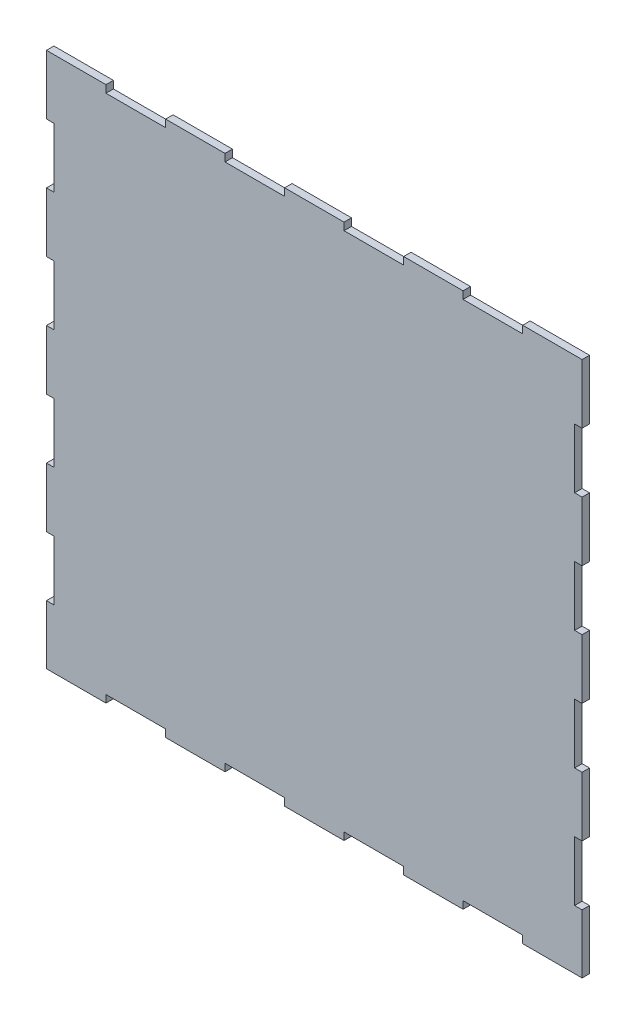
from build123d import *

# Parameters (mm, degrees)
SKETCH2_W           = 114.3
SKETCH2_H           = 114.3
BOSS_EXTRUDE1_DEPTH = 1.5875
SKETCH3_W           = 1.59004
SKETCH3_H           = 12.7254
SKETCH3_W_2         = 12.7254
SKETCH3_H_2         = 1.59004
CUT_EXTRUDE1_DEPTH  = 81.837894309


with BuildPart() as part:
    # Sketch2 → Boss-Extrude1 (new body)
    with BuildSketch(Plane.XY):
        Rectangle(SKETCH2_W, SKETCH2_H)
    extrude(amount=BOSS_EXTRUDE1_DEPTH)

    # Sketch3 → Cut-Extrude1 (cut, through all)
    with BuildSketch(Plane.XY.offset(1.5875)):
        with Locations((-56.35498, 12.6619)):
            Rectangle(SKETCH3_W, SKETCH3_H)
        with Locations((-56.35498, 38.0873)):
            Rectangle(SKETCH3_W, SKETCH3_H)
        with Locations((-56.35498, -12.7635)):
            Rectangle(SKETCH3_W, SKETCH3_H)
        with Locations((-56.35498, -38.1889)):
            Rectangle(SKETCH3_W, SKETCH3_H)
        with Locations((56.35498, 12.6619)):
            Rectangle(SKETCH3_W, SKETCH3_H)
        with Locations((56.35498, 38.0873)):
            Rectangle(SKETCH3_W, SKETCH3_H)
        with Locations((56.35498, -12.7635)):
            Rectangle(SKETCH3_W, SKETCH3_H)
        with Locations((56.35498, -38.1889)):
            Rectangle(SKETCH3_W, SKETCH3_H)
        with Locations((-12.6873, 56.35498)):
            Rectangle(SKETCH3_W_2, SKETCH3_H_2)
        with Locations((-38.0873, 56.35498)):
            Rectangle(SKETCH3_W_2, SKETCH3_H_2)
        with Locations((12.7127, 56.35498)):
            Rectangle(SKETCH3_W_2, SKETCH3_H_2)
        with Locations((38.1127, 56.35498)):
            Rectangle(SKETCH3_W_2, SKETCH3_H_2)
        with Locations((-12.6873, -56.35498)):
            Rectangle(SKETCH3_W_2, SKETCH3_H_2)
        with Locations((-38.0873, -56.35498)):
            Rectangle(SKETCH3_W_2, SKETCH3_H_2)
        with Locations((12.7127, -56.35498)):
            Rectangle(SKETCH3_W_2, SKETCH3_H_2)
        with Locations((38.1127, -56.35498)):
            Rectangle(SKETCH3_W_2, SKETCH3_H_2)
    extrude(amount=-CUT_EXTRUDE1_DEPTH, mode=Mode.SUBTRACT)


solid = part.part
